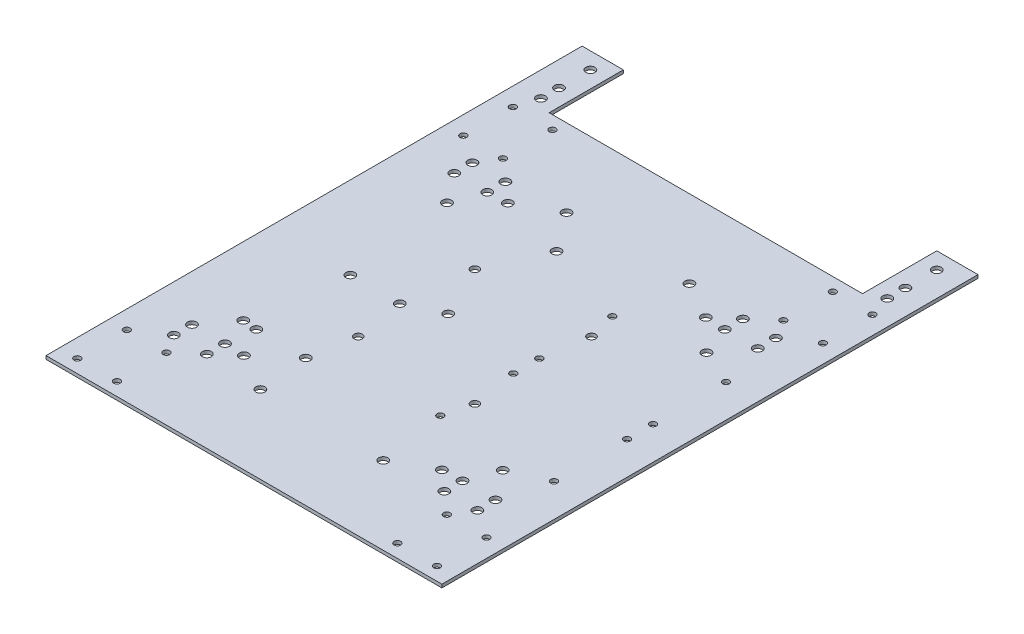
from build123d import *

# Parameters (mm, degrees)
SM_BASE_FLANGE_2_DEPTH   = 2
SKETCH_26_R              = 2
CUT_EXTRUDE_1_DEPTH      = 221.519840377
SKETCH_27_R              = 2.5
CUT_EXTRUDE_2_DEPTH      = 10
SKETCH_28_R              = 2.75
CUT_EXTRUDE_3_DEPTH      = 10
SKETCH_29_R              = 2.75
CUT_EXTRUDE_4_DEPTH      = 10
SKETCH_30_R              = 2.75
CUT_EXTRUDE_5_DEPTH      = 10
MIRROR_3_COPY_1_SKETCH_R = 2.75
MIRROR_3_COPY_1_DEPTH    = 10
SKETCH_31_R              = 2
CUT_EXTRUDE_6_DEPTH      = 10
PATTERN_LINEAR_1_COUNT   = 2
PATTERN_LINEAR_1_PITCH   = 60
SKETCH_32_R              = 2.75
CUT_EXTRUDE_7_DEPTH      = 10
SKETCH_33_R              = 2.75
CUT_EXTRUDE_8_DEPTH      = 10


# Sheet-metal steps are written as plain solids
with BuildPart() as part:
    # 草图2 → 基体-法兰2 (new body)
    with BuildSketch(Plane(origin=(0, 0, 0), x_dir=(1, 0, 0), z_dir=(0, 1, 0))):
        Polygon((-120, 140), (-120, 185), (-95, 185), (-95, 140), (95, 140), (95, 185), (120, 185), (120, 140), (120, -140), (-120, -140), align=None)
    extrude(amount=-SM_BASE_FLANGE_2_DEPTH)

    # 草图26 → 切除-拉伸1 (cut, through all)
    with BuildSketch(Plane(origin=(0, 0, 0), x_dir=(1, 0, 0), z_dir=(0, 1, 0))):
        with Locations(Location((-109, 102, 0), (0, 0, 270))):
            Circle(SKETCH_26_R)
        with Locations(Location((-109, 132, 0), (0, 0, 270))):
            Circle(SKETCH_26_R)
        with Locations(Location((-85, 132, 0), (0, 0, 270))):
            Circle(SKETCH_26_R)
        with Locations(Location((-85, 102, 0), (0, 0, 270))):
            Circle(SKETCH_26_R)
        with Locations(Location((-85, -102, 0), (0, 0, 90))):
            Circle(SKETCH_26_R)
        with Locations(Location((-85, -132, 0), (0, 0, 90))):
            Circle(SKETCH_26_R)
        with Locations(Location((-109, -132, 0), (0, 0, 90))):
            Circle(SKETCH_26_R)
        with Locations(Location((-109, -102, 0), (0, 0, 90))):
            Circle(SKETCH_26_R)
        with Locations(Location((85, 102, 0), (0, 0, 90))):
            Circle(SKETCH_26_R)
        with Locations(Location((85, 132, 0), (0, 0, 90))):
            Circle(SKETCH_26_R)
        with Locations(Location((109, 132, 0), (0, 0, 90))):
            Circle(SKETCH_26_R)
        with Locations(Location((109, 102, 0), (0, 0, 90))):
            Circle(SKETCH_26_R)
        with Locations(Location((109, -102, 0), (0, 0, 270))):
            Circle(SKETCH_26_R)
        with Locations(Location((109, -132, 0), (0, 0, 270))):
            Circle(SKETCH_26_R)
        with Locations(Location((85, -132, 0), (0, 0, 270))):
            Circle(SKETCH_26_R)
        with Locations(Location((85, -102, 0), (0, 0, 270))):
            Circle(SKETCH_26_R)
    extrude(amount=-CUT_EXTRUDE_1_DEPTH, mode=Mode.SUBTRACT)

    # 草图27 → 切除-拉伸2 (cut)
    with BuildSketch(Plane.XZ.offset(2)):
        with Locations(Location((-35.355339059, 35.355339059, 0), (0, 0, 270))):
            Circle(SKETCH_27_R)
        with Locations(Location((35.355339059, 35.355339059, 0), (0, 0, 270))):
            Circle(SKETCH_27_R)
        with Locations(Location((35.355339059, -35.355339059, 0), (0, 0, 270))):
            Circle(SKETCH_27_R)
        with Locations(Location((-35.355339059, -35.355339059, 0), (0, 0, 270))):
            Circle(SKETCH_27_R)
    extrude(amount=-CUT_EXTRUDE_2_DEPTH, mode=Mode.SUBTRACT)

    # 草图28 → 切除-拉伸3 (cut)
    with BuildSketch(Plane.XZ.offset(2)):
        with Locations(Location((-60, -80, 0), (0, 0, 270))):
            Circle(SKETCH_28_R)
        with Locations(Location((-37.250025969, -92.803208809, 0), (0, 0, 270))):
            Circle(SKETCH_28_R)
        with Locations(Location((-78.661073186, -61.744923397, 0), (0, 0, 270))):
            Circle(SKETCH_28_R)
        with Locations(Location((78.661073186, -61.744923397, 0), (0, 0, 90))):
            Circle(SKETCH_28_R)
        with Locations(Location((37.250025969, -92.803208809, 0), (0, 0, 90))):
            Circle(SKETCH_28_R)
        with Locations(Location((60, -80, 0), (0, 0, 90))):
            Circle(SKETCH_28_R)
        with Locations(Location((-78.661073186, 61.744923397, 0), (0, 0, 90))):
            Circle(SKETCH_28_R)
        with Locations(Location((-37.250025969, 92.803208809, 0), (0, 0, 90))):
            Circle(SKETCH_28_R)
        with Locations(Location((-60, 80, 0), (0, 0, 90))):
            Circle(SKETCH_28_R)
        with Locations(Location((60, 80, 0), (0, 0, 270))):
            Circle(SKETCH_28_R)
        with Locations(Location((37.250025969, 92.803208809, 0), (0, 0, 270))):
            Circle(SKETCH_28_R)
        with Locations(Location((78.661073186, 61.744923397, 0), (0, 0, 270))):
            Circle(SKETCH_28_R)
    extrude(amount=-CUT_EXTRUDE_3_DEPTH, mode=Mode.SUBTRACT)

    # 草图29 → 切除-拉伸4 (cut)
    with BuildSketch(Plane.XZ.offset(2)):
        with Locations(Location((105, -175, 0), (0, 0, 270))):
            Circle(SKETCH_29_R)
        with Locations(Location((105, -156, 0), (0, 0, 270))):
            Circle(SKETCH_29_R)
        with Locations(Location((105, -145, 0), (0, 0, 270))):
            Circle(SKETCH_29_R)
    cut_extrude_4 = extrude(amount=-CUT_EXTRUDE_4_DEPTH, mode=Mode.SUBTRACT)

    # 镜向1: 切除-拉伸4 across plane
    add(cut_extrude_4.mirror(Plane(origin=(0, 0, 0), x_dir=(0, 0, 1), z_dir=(1, 0, 0))), mode=Mode.SUBTRACT)

    # 草图30 → 切除-拉伸5 (cut)
    with BuildSketch(Plane(origin=(0, 0, 0), x_dir=(1, 0, 0), z_dir=(0, 1, 0))):
        with Locations(Location((-92, 90.5, 0), (0, 0, 270))):
            Circle(SKETCH_30_R)
        with Locations(Location((-92, 79.5, 0), (0, 0, 270))):
            Circle(SKETCH_30_R)
        with Locations(Location((-72, 79.5, 0), (0, 0, 270))):
            Circle(SKETCH_30_R)
        with Locations(Location((-72, 90.5, 0), (0, 0, 270))):
            Circle(SKETCH_30_R)
    cut_extrude_5 = extrude(amount=-CUT_EXTRUDE_5_DEPTH, mode=Mode.SUBTRACT)

    # 镜向2: 切除-拉伸5 across plane
    add(cut_extrude_5.mirror(Plane.XY), mode=Mode.SUBTRACT)

    # 镜向3: 切除-拉伸5 across plane
    add(cut_extrude_5.mirror(Plane(origin=(0, 0, 0), x_dir=(0, 0, 1), z_dir=(1, 0, 0))), mode=Mode.SUBTRACT)

    # 镜向3 copy 1 sketch → 镜向3 copy 1 (cut)
    with BuildSketch(Plane(origin=(0, 0, 0), x_dir=(-1, 0, 0), z_dir=(0, 1, 0))):
        with Locations(Location((-92, 90.5, 0), (0, 0, 270))):
            Circle(MIRROR_3_COPY_1_SKETCH_R)
        with Locations(Location((-92, 79.5, 0), (0, 0, 270))):
            Circle(MIRROR_3_COPY_1_SKETCH_R)
        with Locations(Location((-72, 79.5, 0), (0, 0, 270))):
            Circle(MIRROR_3_COPY_1_SKETCH_R)
        with Locations(Location((-72, 90.5, 0), (0, 0, 270))):
            Circle(MIRROR_3_COPY_1_SKETCH_R)
    extrude(amount=-MIRROR_3_COPY_1_DEPTH, mode=Mode.SUBTRACT)

    # 草图31 → 切除-拉伸6 (cut)
    with BuildSketch(Plane(origin=(0, 0, 0), x_dir=(1, 0, 0), z_dir=(0, 1, 0))):
        with Locations(Location((31.05, -52, 0), (0, 0, 270))):
            Circle(SKETCH_31_R)
        with Locations(Location((31.05, -7.74, 0), (0, 0, 270))):
            Circle(SKETCH_31_R)
        with Locations(Location((100, -7.74, 0), (0, 0, 270))):
            Circle(SKETCH_31_R)
        with Locations(Location((100, -52, 0), (0, 0, 270))):
            Circle(SKETCH_31_R)
    cut_extrude_6 = extrude(amount=-CUT_EXTRUDE_6_DEPTH, mode=Mode.SUBTRACT)

    # 阵列(线性)1: 切除-拉伸6 ×2
    with Locations(*[(0, 0, -i * PATTERN_LINEAR_1_PITCH) for i in range(1, PATTERN_LINEAR_1_COUNT)]):
        add(cut_extrude_6, mode=Mode.SUBTRACT)

    # 草图32 → 切除-拉伸7 (cut)
    with BuildSketch(Plane(origin=(0, 0, 0), x_dir=(1, 0, 0), z_dir=(0, 1, 0))):
        with Locations(Location((-20, 69.5, 0), (0, 0, 270))):
            Circle(SKETCH_32_R)
        with Locations(Location((-20, 3.8, 0), (0, 0, 270))):
            Circle(SKETCH_32_R)
    extrude(amount=-CUT_EXTRUDE_7_DEPTH, mode=Mode.SUBTRACT)

    # 草图33 → 切除-拉伸8 (cut)
    with BuildSketch(Plane(origin=(0, 0, 0), x_dir=(1, 0, 0), z_dir=(0, 1, 0))):
        with Locations(Location((-70, -62.5, 0), (0, 0, 270))):
            Circle(SKETCH_33_R)
        with Locations(Location((-70, -5.5, 0), (0, 0, 270))):
            Circle(SKETCH_33_R)
        with Locations(Location((-40, -5.5, 0), (0, 0, 270))):
            Circle(SKETCH_33_R)
        with Locations(Location((-40, -62.5, 0), (0, 0, 270))):
            Circle(SKETCH_33_R)
    extrude(amount=-CUT_EXTRUDE_8_DEPTH, mode=Mode.SUBTRACT)


solid = part.part
